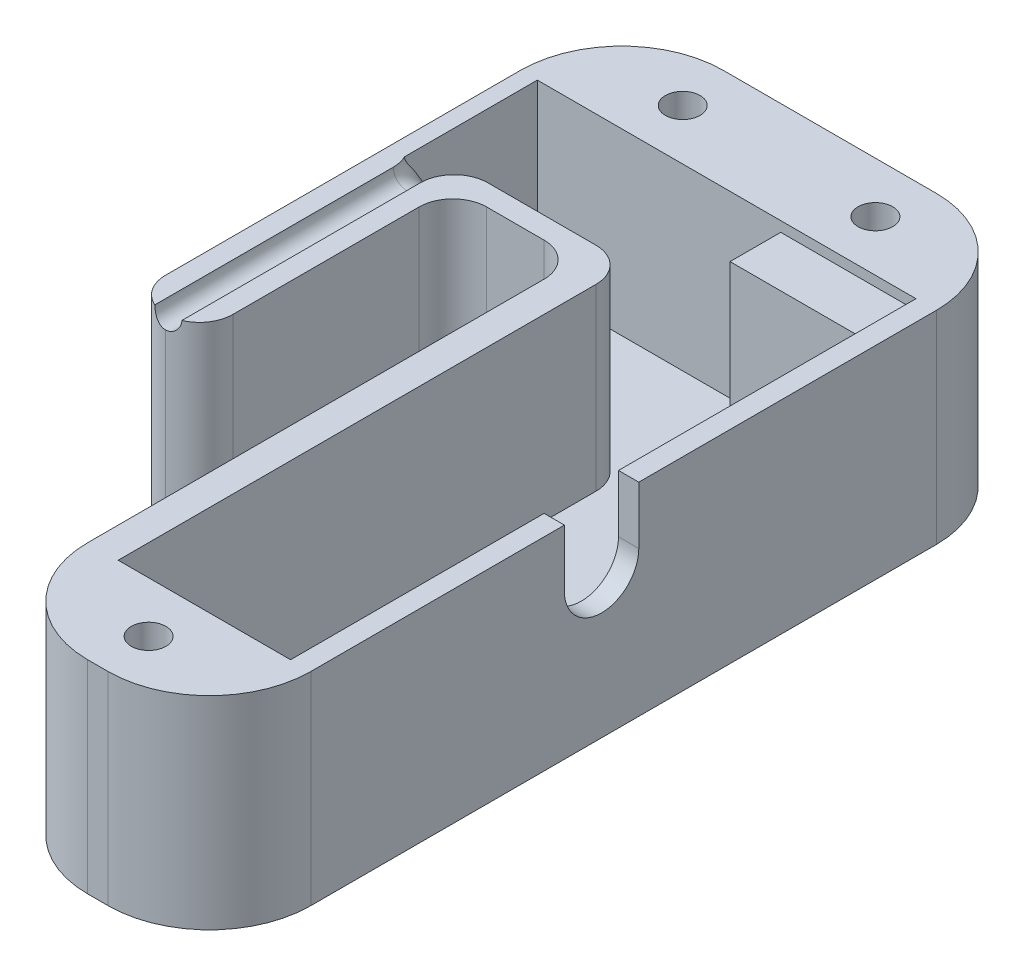
from build123d import *

# Parameters (mm, degrees)
BOSS_EXTRUDE1_DEPTH = 12
CUT_EXTRUDE1_DEPTH  = 10.6
SKETCH3_R           = 0.8
CUT_EXTRUDE2_DEPTH  = 16.274572476
SKETCH4_R           = 1.025
CUT_EXTRUDE3_DEPTH  = 6
FILLET1_R           = 6
FILLET2_R           = 2
CUT_EXTRUDE4_DEPTH  = 1.2
FILLET3_R           = 2
SKETCH6_W           = 8
SKETCH6_H           = 3
BOSS_EXTRUDE2_DEPTH = 10


# Some blends are built 0.0001 mm under size
with BuildPart() as part:
    # Sketch1 → Boss-Extrude1 (new body)
    with BuildSketch(Plane(origin=(0, 0, 0), x_dir=(1, 0, 0), z_dir=(0, 1, 0))):
        Polygon((-16.635707691, 24.623874564), (7.964292309, 24.623874564), (7.964292309, -24.376125436), (-5.235707691, -24.376125436), (-5.235707691, 10.623874564), (-12.635707691, 10.623874564), (-12.635707691, -4.376125436), (-16.635707691, -4.376125436), align=None)
    extrude(amount=BOSS_EXTRUDE1_DEPTH)

    # Sketch2 → Cut-Extrude1 (cut)
    with BuildSketch(Plane(origin=(0, 12, 0), x_dir=(1, 0, 0), z_dir=(0, 1, 0))):
        Polygon((-3.435707691, -18.376125436), (6.764292309, -18.376125436), (6.764292309, 18.623874564), (-15.635707691, 18.623874564), (-15.635707691, 11.89844704), (-3.435707691, 11.89844704), align=None)
    extrude(amount=-CUT_EXTRUDE1_DEPTH, mode=Mode.SUBTRACT)

    # Sketch3 → Cut-Extrude2 (cut)
    with BuildSketch(Plane.XY.offset(4.376125436)):
        with Locations((-14.635707691, 12)):
            Circle(SKETCH3_R)
    extrude(amount=-CUT_EXTRUDE2_DEPTH, mode=Mode.SUBTRACT)

    # Sketch4 → Cut-Extrude3 (cut)
    with BuildSketch(Plane(origin=(0, 12, 0), x_dir=(1, 0, 0), z_dir=(0, 1, 0))):
        with Locations(Location((-10.035707691, 21.623874564, 0), (0, 0, 270))):
            Circle(SKETCH4_R)
        with Locations(Location((1.364292309, 21.623874564, 0), (0, 0, 270))):
            Circle(SKETCH4_R)
        with Locations(Location((1.364292309, -21.376125436, 0), (0, 0, 270))):
            Circle(SKETCH4_R)
    extrude(amount=-CUT_EXTRUDE3_DEPTH, mode=Mode.SUBTRACT)

    # Fillet1
    fillet1_edges = [part.edges().sort_by_distance(p)[0] for p in [
        (-16.635707691, 6, -24.623874564),
        (7.964292309, 6, -24.623874564),
        (7.964292309, 6, 24.376125436),
        (-5.235707691, 6, 24.376125436),
    ]]
    fillet(fillet1_edges, radius=FILLET1_R)

    # Fillet2
    fillet2_edges = [part.edges().sort_by_distance(p)[0] for p in [
        (-5.235707691, 6, -10.623874564),
        (-12.635707691, 6, -10.623874564),
        (-12.635707691, 6, 4.376125436),
        (-16.635707691, 6, 4.376125436),
    ]]
    fillet(fillet2_edges, radius=FILLET2_R - 0.0001)  # a hair under: the kernel refuses the full size

    # Sketch5 → Cut-Extrude4 (cut)
    with BuildSketch(Plane(origin=(7.964292309, 0, 0), x_dir=(0, 0, -1), z_dir=(1, 0, 0))):
        with BuildLine():
            Line((-3.376125436, 8.6), (-3.376125436, 12))
            Line((-3.376125436, 12), (1.023874564, 12))
            Line((1.023874564, 12), (1.023874564, 8.6))
            ThreePointArc((1.023874564, 8.6), (-1.176125436, 6.4), (-3.376125436, 8.6))
        make_face()
    extrude(amount=-CUT_EXTRUDE4_DEPTH, mode=Mode.SUBTRACT)

    # Fillet3
    # the kernel refuses this fillet: 2 mm, written as the material it takes off along each edge
    with BuildSketch(Plane(origin=(-3.435707691, 17, -11.89844704), x_dir=(-1, 0, 0), z_dir=(0, -1, 0))) as fillet3_piece_1:
        with BuildLine():
            CenterArc((FILLET3_R, -FILLET3_R), FILLET3_R, 90, 90)
            Line((0, -FILLET3_R), (0, 0))
            Line((0, 0), (FILLET3_R, 0))
        make_face()
    extrude(amount=15.6, mode=Mode.SUBTRACT)
    with BuildSketch(Plane(origin=(-14.635707691, 12, -11.89844704), x_dir=(-0.0031415874858797778, 0.9999950652018582, 0), z_dir=(0.9999950652018582, 0.0031415874858797778, 0))) as fillet3_piece_2_section:
        with BuildLine():
            CenterArc((0.8 + FILLET3_R, 0 + FILLET3_R), FILLET3_R, 180, 90)
            Line((0.8 + FILLET3_R, 0), (0.8, 0))
            Line((0.8, 0), (0.8, 0 + FILLET3_R))
        make_face()
    fillet3_piece_2 = revolve(axis=Axis((-14.635707691, 12, -11.89844704), (0, 0, 1)), revolution_arc=359.64, mode=Mode.PRIVATE)
    fillet3_piece_2 = split(fillet3_piece_2, bisect_by=Plane(origin=(-15.635707691, 11.089592245, -11.483446459), z_dir=(1, 0, 0)), keep=Keep.TOP, mode=Mode.PRIVATE)
    add(fillet3_piece_2, mode=Mode.SUBTRACT)

    # Sketch6 → Boss-Extrude2 (add)
    with BuildSketch(Plane(origin=(0, 1.4, 0), x_dir=(1, 0, 0), z_dir=(0, 1, 0))):
        with Locations((2.764292309, 17.123874564)):
            Rectangle(SKETCH6_W, SKETCH6_H)
    extrude(amount=BOSS_EXTRUDE2_DEPTH)


solid = part.part
